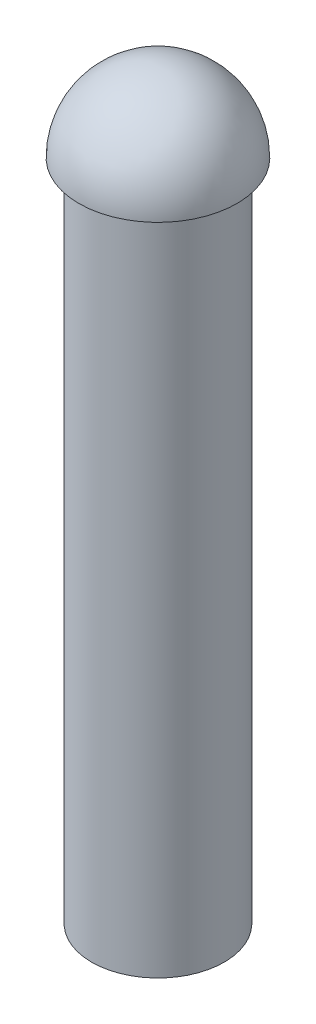
from build123d import *

# Parameters (mm, degrees)
REVOLVE_1_ANGLE              = 180
SKETCH_6_W                   = 6.5
SKETCH_6_H                   = 65
HOLE_WIZARD_M8_1_D           = 6.8
HOLE_WIZARD_M8_1_DEPTH       = 30
HOLE_WIZARD_M8_1_CSINK_D     = 8.05
HOLE_WIZARD_M8_1_CSINK_ANGLE = 90
HOLE_WIZARD_M8_1_TIP         = 2.042926105
THREAD_1_PITCH               = 1.25


with BuildPart() as part:
    # Sketch 1 → 旋转1 (revolve)
    with BuildSketch(Plane(origin=(0, 0, 0), x_dir=(1, 0, 0), z_dir=(0, 1, 0))):
        with BuildLine():
            Line((0, 7.75), (0, -7.75))
            ThreePointArc((0, -7.75), (7.75, 0), (0, 7.75))
        make_face()
    revolve(axis=Axis((0, 0, -7.75), (0, 0, 1)), revolution_arc=REVOLVE_1_ANGLE)

    # 草图6 → 旋转2 (revolve)
    with BuildSketch(Plane(origin=(0, 0, 0), x_dir=(0, 0, -1), z_dir=(1, 0, 0)), mode=Mode.PRIVATE) as revolve_2_sk:
        with Locations((3.25, -32.5)):
            Rectangle(SKETCH_6_W, SKETCH_6_H)
    revolve(revolve_2_sk.sketch.rotate(Axis((0, 0, 0), (0, -1, 0)), 180), axis=Axis((0, 0, 0), (0, -1, 0)))

    # M8 螺纹孔1
    with Locations(Plane(origin=(0, -65, 0), x_dir=(0, 0, -1), z_dir=(0, -1, 0))):
        with Locations((0, 0)):
            CounterSinkHole(HOLE_WIZARD_M8_1_D / 2, HOLE_WIZARD_M8_1_CSINK_D / 2, depth=HOLE_WIZARD_M8_1_DEPTH, counter_sink_angle=HOLE_WIZARD_M8_1_CSINK_ANGLE)
            with Locations((0, 0, -(HOLE_WIZARD_M8_1_DEPTH + HOLE_WIZARD_M8_1_TIP / 2))):  # 118° drill point
                Cone(0, HOLE_WIZARD_M8_1_D / 2, HOLE_WIZARD_M8_1_TIP, mode=Mode.SUBTRACT)

    # 螺纹线1: the profile of Sketch 1 2 profile screwed along a right-hand helix of 24 turns, 8 arcs to a turn; built about Z, then put on its axis
    thread_1_z = Axis((0, 0, 0), (0, 0, 1))
    thread_1_corners = [(3.3997, 0, -0.000173205), (4.076582344, 0, 0.390624998), (4.076582344, 0, 0.546874998), (3.3997, 0, 0.937673202)]
    with BuildLine(mode=Mode.PRIVATE) as thread_1_profile:
        Line(thread_1_corners[0], thread_1_corners[1])
        Line(thread_1_corners[1], thread_1_corners[2])
        Line(thread_1_corners[2], thread_1_corners[3])
        Line(thread_1_corners[3], thread_1_corners[0])
    thread_1_cap = Face(thread_1_profile.wire())
    thread_1_turn_angles = [0, 22.5, 45, 67.5, 90, 112.5, 135, 157.5, 180, 202.5, 225, 247.5, 270, 292.5, 315, 337.5, 360]
    thread_1_turn_weights = [1, 0.9238795325112867, 1, 0.9238795325112867, 1, 0.9238795325112867, 1, 0.9238795325112867, 1, 0.9238795325112867, 1, 0.9238795325112867, 1, 0.9238795325112867, 1, 0.9238795325112867, 1]
    thread_1_turn_rails = [Edge.make_bspline([Vector(p[0], p[1], 0).rotate(thread_1_z, thread_1_turn_angles[k]) / thread_1_turn_weights[k] + Vector(0, 0, p[2] + THREAD_1_PITCH * thread_1_turn_angles[k] / 360) for k in range(17)], [0, 0, 0, 1, 1, 2, 2, 3, 3, 4, 4, 5, 5, 6, 6, 7, 7, 8, 8, 8], 2, thread_1_turn_weights) for p in thread_1_corners]
    thread_1_turn_sides = [Face.make_surface_from_curves(thread_1_turn_rails[p[0]], thread_1_turn_rails[p[1]]) for p in [(0, 1), (1, 2), (2, 3), (3, 0)]]
    thread_1 = Plane(origin=(0, -65, 0), x_dir=(1, 0, 0), z_dir=(0, 1, 0)) * Solid(Shell([*[p.moved(Location((0, 0, THREAD_1_PITCH * i))) for i in range(24) for p in thread_1_turn_sides], thread_1_cap, thread_1_cap.rotate(thread_1_z, 8640).moved(Location((0, 0, THREAD_1_PITCH * 8640 / 360)))]))
    add(thread_1, mode=Mode.SUBTRACT)


solid = part.part
